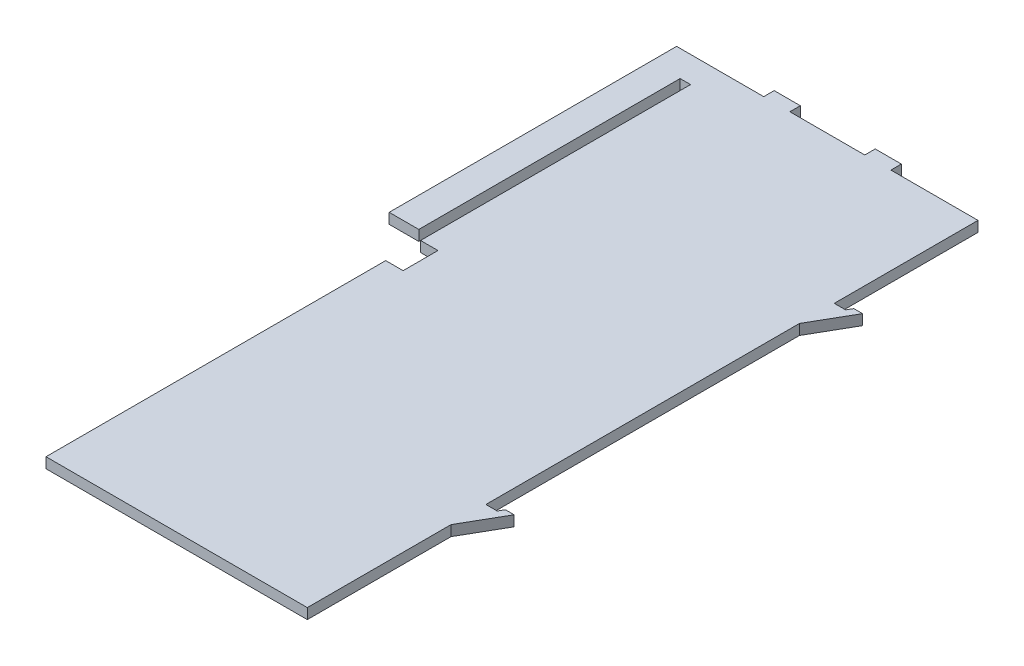
from build123d import *

# Parameters (mm, degrees)
BOSS_EXTRUDE1_DEPTH = 6


with BuildPart() as part:
    # Sketch1 → Boss-Extrude1 (new body)
    with BuildSketch(Plane(origin=(0, 0, 0), x_dir=(1, 0, 0), z_dir=(0, 1, 0))):
        Polygon((0, 0), (0, 165), (50, 165), (50, 171), (65, 171), (65, 165), (108, 165), (108, 171), (123, 171), (123, 165), (173, 165), (173, 82.5), (179.5, 82.5), (181.225, 85.5), (186.225, 85.5), (173, 62.5), (173, -117.5), (179.5, -117.5), (181.225, -114.5), (186.225, -114.5), (173, -137.5), (173, -220), (23, -220), (23, -25), (33, -25), (33, -5), (23, -5), (23, 150), (17, 150), (17, 0), align=None)
    extrude(amount=BOSS_EXTRUDE1_DEPTH)


solid = part.part
